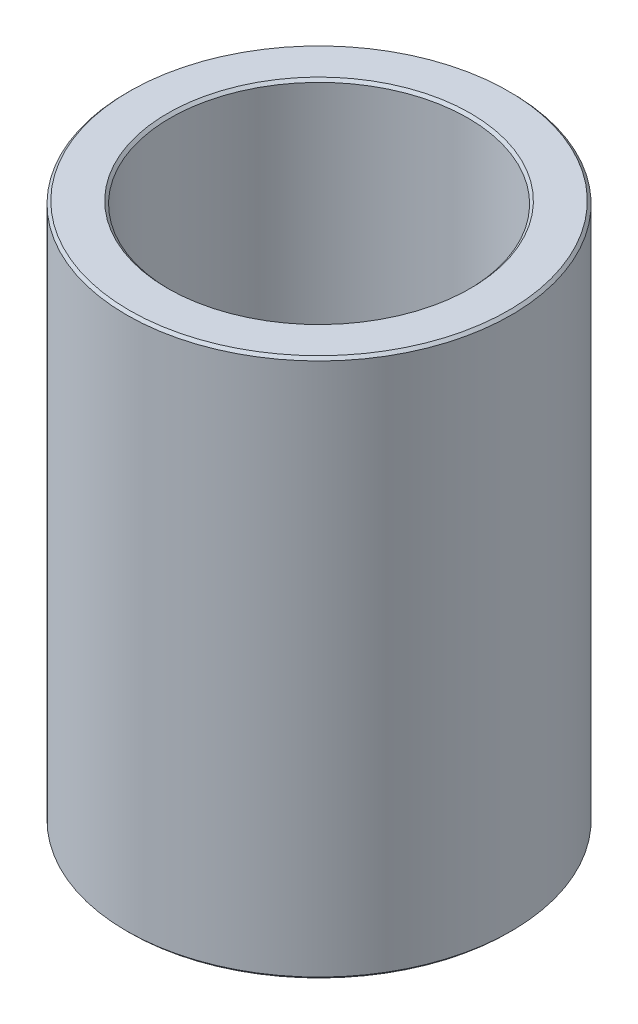
from build123d import *

# Parameters (mm, degrees)
SKETCH1_R           = 57.5
BOSS_EXTRUDE1_DEPTH = 161.072596288
SKETCH2_R           = 44.500092905
CUT_EXTRUDE1_DEPTH  = 181.435255078
CHAMFER1_SIZE       = 0.802652887


with BuildPart() as part:
    # Sketch1 → Boss-Extrude1 (new body)
    with BuildSketch(Plane(origin=(0, 0, 0), x_dir=(1, 0, 0), z_dir=(0, 1, 0))):
        Circle(SKETCH1_R)
    extrude(amount=BOSS_EXTRUDE1_DEPTH)

    # Sketch2 → Cut-Extrude1 (cut, through all)
    with BuildSketch(Plane(origin=(0, 0, 0), x_dir=(1, 0, 0), z_dir=(0, 1, 0))):
        Circle(SKETCH2_R)
    extrude(amount=CUT_EXTRUDE1_DEPTH, mode=Mode.SUBTRACT)

    # Chamfer1
    chamfer1_edges = [part.edges().sort_by_distance(p)[0] for p in [
        (-44.500092905, 161.072596288, 0),
        (-44.500092905, 0, 0),
        (-57.5, 0, 0),
        (-57.5, 161.072596288, 0),
    ]]
    chamfer(chamfer1_edges, length=CHAMFER1_SIZE)


solid = part.part
